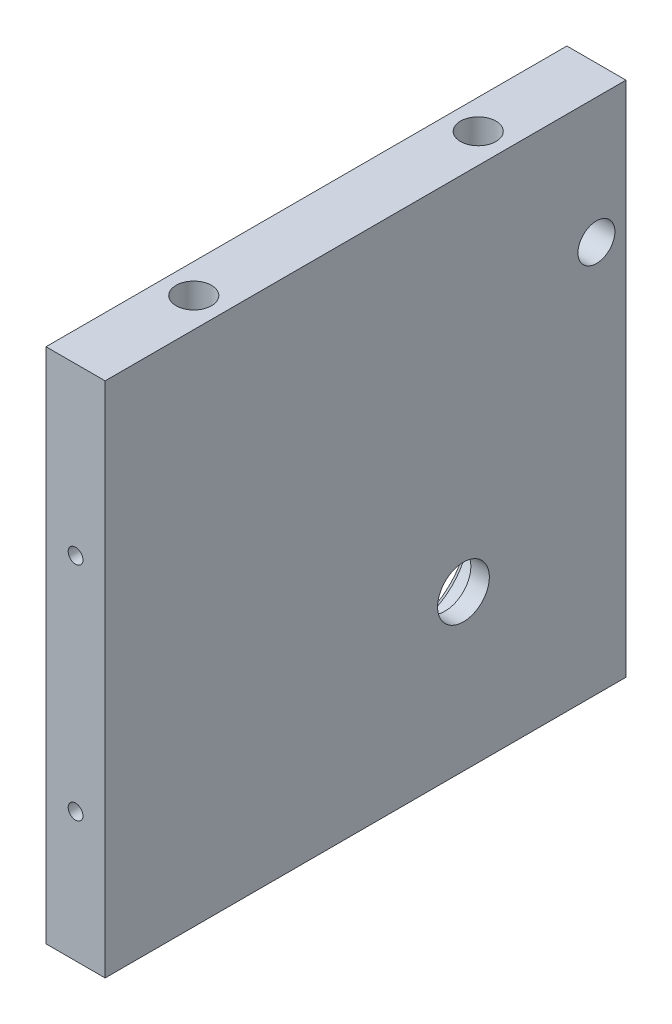
from build123d import *

# Parameters (mm, degrees)
SKETCH1_W                                           = 85
SKETCH1_H                                           = 70.5
BOSS_EXTRUDE1_DEPTH                                 = 70
SHELL1_T                                            = 8
CUT_EXTRUDE1_REACH                                  = 132.275
SKETCH2_R                                           = 3.5
CUT_EXTRUDE1_DIRECTION_2_DEPTH                      = 131.274949626
CBORE_FOR_M3_HEX_SOCKET_HEAD_CAP_SCREW1_D           = 3.8
CBORE_FOR_M3_HEX_SOCKET_HEAD_CAP_SCREW1_DEPTH       = 10
CBORE_FOR_M3_HEX_SOCKET_HEAD_CAP_SCREW1_CBORE_D     = 8
CBORE_FOR_M3_HEX_SOCKET_HEAD_CAP_SCREW1_CBORE_DEPTH = 3.4
CBORE_FOR_M3_HEX_SOCKET_HEAD_CAP_SCREW1_TIP         = 1.141635176
SKETCH14_W                                          = 12
SKETCH14_H                                          = 14
CUT_EXTRUDE3_DEPTH                                  = 5.5
SKETCH15_R                                          = 3.45
CUT_EXTRUDE4_DEPTH                                  = 101.60349149
SKETCH16_W                                          = 12
SKETCH16_H                                          = 2.5
CUT_EXTRUDE5_DEPTH                                  = 1.5
SKETCH17_W                                          = 7.1
SKETCH17_H                                          = 4.1
SKETCH17_W_2                                        = 7.8
SKETCH17_H_2                                        = 6
CUT_EXTRUDE6_DEPTH                                  = 97.544355091
CUT_EXTRUDE7_DEPTH                                  = 97.544355091
CUT_EXTRUDE8_DEPTH                                  = 125.175531003
CHAMFER2_SIZE                                       = 1
LPATTERN1_COUNT                                     = 5
LPATTERN1_PITCH                                     = 8
CHAMFER2_OF_LPATTERN1_SIZE                          = 1
CBORE_FOR_M3_HEX_SOCKET_HEAD_CAP_SCREW4_D           = 3.6
CBORE_FOR_M3_HEX_SOCKET_HEAD_CAP_SCREW4_DEPTH       = 10
CBORE_FOR_M3_HEX_SOCKET_HEAD_CAP_SCREW4_CBORE_D     = 6.5
CBORE_FOR_M3_HEX_SOCKET_HEAD_CAP_SCREW4_CBORE_DEPTH = 3.4
CBORE_FOR_M3_HEX_SOCKET_HEAD_CAP_SCREW4_TIP         = 1.081549114
SKETCH26_R                                          = 7.75
CUT_EXTRUDE9_DEPTH                                  = 5.5
CHAMFER1_SIZE                                       = 1
SKETCH28_R                                          = 2.4
CUT_EXTRUDE11_DEPTH                                 = 5.5
CHAMFER3_SIZE                                       = 1
FILLET4_R                                           = 3
SKETCH34_R                                          = 1
CUT_EXTRUDE13_DEPTH                                 = 20
CUT_EXTRUDE14_START                                 = -8
SKETCH35_R                                          = 2.4
CUT_EXTRUDE14_DEPTH                                 = 5.5
CBORE_FOR_M3_HEX_SOCKET_HEAD_CAP_SCREW5_D           = 3.6
CBORE_FOR_M3_HEX_SOCKET_HEAD_CAP_SCREW5_DEPTH       = 13.499
CBORE_FOR_M3_HEX_SOCKET_HEAD_CAP_SCREW5_CBORE_D     = 6.5
CBORE_FOR_M3_HEX_SOCKET_HEAD_CAP_SCREW5_CBORE_DEPTH = 3.4
SKETCH40_R                                          = 2.5
CUT_EXTRUDE16_DEPTH                                 = 131.274949737
CBORE_FOR_M4_HEX_SOCKET_HEAD_CAP_SCREW1_D           = 4.5
CBORE_FOR_M4_HEX_SOCKET_HEAD_CAP_SCREW1_DEPTH       = 18
CBORE_FOR_M4_HEX_SOCKET_HEAD_CAP_SCREW1_CBORE_D     = 8
CBORE_FOR_M4_HEX_SOCKET_HEAD_CAP_SCREW1_CBORE_DEPTH = 4.4
CBORE_FOR_M3_HEX_SOCKET_HEAD_CAP_SCREW6_D           = 3.4
CBORE_FOR_M3_HEX_SOCKET_HEAD_CAP_SCREW6_DEPTH       = 18
CBORE_FOR_M3_HEX_SOCKET_HEAD_CAP_SCREW6_CBORE_D     = 6.5
CBORE_FOR_M3_HEX_SOCKET_HEAD_CAP_SCREW6_CBORE_DEPTH = 3.4
CBORE_FOR_M3_HEX_SOCKET_HEAD_CAP_SCREW6_TIP         = 1.021463052
CUT_EXTRUDE18_REACH                                 = 124.199
SKETCH53_W                                          = 10
SKETCH53_H                                          = 6.8
SPLIT5_START                                        = -8
SPLIT5_OUTLINE_W                                    = 14
SPLIT5_OUTLINE_H                                    = 12
SPLIT5_OUTLINE_R                                    = 3.45
SPLIT5_OUTLINE_R_2                                  = 3.25
SPLIT5_OUTLINE_R_3                                  = 1.8
SPLIT5_OUTLINE_R_4                                  = 1.7
SPLIT5_DEPTH                                        = 78
SPLIT5_2_OUTLINE_W                                  = 14
SPLIT5_2_OUTLINE_H                                  = 12
SPLIT5_2_OUTLINE_R                                  = 3.25
SPLIT5_2_OUTLINE_W_2                                = 7.1
SPLIT5_2_OUTLINE_H_2                                = 4.1
SPLIT5_2_OUTLINE_W_3                                = 7.8
SPLIT5_2_OUTLINE_H_3                                = 6
SPLIT5_2_OUTLINE_R_2                                = 1.8
SPLIT5_2_DEPTH                                      = 8


# Read off the part's stored shape, not the designer's step: Split5
with BuildPart() as part:
    # Sketch1 → Boss-Extrude1 (new body)
    with BuildSketch(Plane(origin=(0, 0, 0), x_dir=(1, 0, 0), z_dir=(0, 1, 0))):
        Rectangle(SKETCH1_W, SKETCH1_H)
    extrude(amount=BOSS_EXTRUDE1_DEPTH)

    # Shell1
    shell1_openings = [part.faces().sort_by_distance(p)[0] for p in [
        (0, 70, 0),
    ]]
    offset(amount=SHELL1_T, openings=shell1_openings, kind=Kind.INTERSECTION)

    # Sketch2 → Cut-Extrude1 (cut, up to next)
    with BuildSketch(Plane(origin=(50.5, 0, 0), x_dir=(0, 0, -1), z_dir=(1, 0, 0)), mode=Mode.PRIVATE) as cut_extrude1_sk1:
        with Locations(Location((13.25, 21, 0), (0, 0, 180))):
            Circle(SKETCH2_R)
    cut_extrude1_tool1 = extrude(cut_extrude1_sk1.sketch, amount=-CUT_EXTRUDE1_REACH, mode=Mode.PRIVATE) & part.part
    add(cut_extrude1_tool1.solids().sort_by_distance((50.5, 21, -13.25))[0], mode=Mode.SUBTRACT)

    # Sketch2 → Cut-Extrude1 direction 2 (cut)
    with BuildSketch(Plane(origin=(50.5, 0, 0), x_dir=(0, 0, -1), z_dir=(1, 0, 0))):
        with Locations(Location((13.25, 21, 0), (0, 0, 180))):
            Circle(SKETCH2_R)
    extrude(amount=CUT_EXTRUDE1_DIRECTION_2_DEPTH, mode=Mode.SUBTRACT)

    # CBORE for M3 Hex Socket Head Cap Screw1
    with Locations(Plane.XY.offset(43.25)):
        with Locations((-34, 55.5), (-3, 55.5), (-34, 24.5)):
            CounterBoreHole(CBORE_FOR_M3_HEX_SOCKET_HEAD_CAP_SCREW1_D / 2, CBORE_FOR_M3_HEX_SOCKET_HEAD_CAP_SCREW1_CBORE_D / 2, CBORE_FOR_M3_HEX_SOCKET_HEAD_CAP_SCREW1_CBORE_DEPTH, depth=CBORE_FOR_M3_HEX_SOCKET_HEAD_CAP_SCREW1_DEPTH)
            with Locations((0, 0, -(CBORE_FOR_M3_HEX_SOCKET_HEAD_CAP_SCREW1_DEPTH + CBORE_FOR_M3_HEX_SOCKET_HEAD_CAP_SCREW1_TIP / 2))):  # 118° drill point
                Cone(0, CBORE_FOR_M3_HEX_SOCKET_HEAD_CAP_SCREW1_D / 2, CBORE_FOR_M3_HEX_SOCKET_HEAD_CAP_SCREW1_TIP, mode=Mode.SUBTRACT)

    # Sketch14 → Cut-Extrude3 (cut)
    with BuildSketch(Plane(origin=(-42.5, 0, 0), x_dir=(0, 0, -1), z_dir=(0, 1, 0))):
        with Locations((-17.25, -13)):
            Rectangle(SKETCH14_W, SKETCH14_H)
    extrude(amount=-CUT_EXTRUDE3_DEPTH, mode=Mode.SUBTRACT)

    # Sketch15 → Cut-Extrude4 (cut, through all)
    with BuildSketch(Plane(origin=(0, -5.5, 0), x_dir=(0, 0, -1), z_dir=(0, 1, 0))):
        with Locations(Location((-17.25, 29.5, 0), (0, 0, 90))):
            Circle(SKETCH15_R)
    extrude(amount=-CUT_EXTRUDE4_DEPTH, mode=Mode.SUBTRACT)

    # Sketch16 → Cut-Extrude5 (cut)
    with BuildSketch(Plane(origin=(0, -5.5, 0), x_dir=(0, 0, -1), z_dir=(0, 1, 0))):
        with Locations((-17.25, 35.25)):
            Rectangle(SKETCH16_W, SKETCH16_H)
    extrude(amount=-CUT_EXTRUDE5_DEPTH, mode=Mode.SUBTRACT)

    # Sketch17 → Cut-Extrude6 (cut, through all)
    with BuildSketch(Plane(origin=(0, 0, 0), x_dir=(1, 0, 0), z_dir=(0, 1, 0))):
        with Locations((19.15, -29.25)):
            Rectangle(SKETCH17_W, SKETCH17_H)
        with Locations((30.6, -29.25)):
            Rectangle(SKETCH17_W_2, SKETCH17_H_2)
    extrude(amount=-CUT_EXTRUDE6_DEPTH, mode=Mode.SUBTRACT)

    # Sketch18 → Cut-Extrude7 (cut, through all)
    with BuildSketch(Plane(origin=(0, 0, 0), x_dir=(1, 0, 0), z_dir=(0, 1, 0))):
        with BuildLine():
            Line((-19.5, -29.25), (-19.5, -21.25))
            ThreePointArc((-19.5, -21.25), (-17.5, -19.25), (-15.5, -21.25))
            Line((-15.5, -21.25), (-15.5, -29.25))
            ThreePointArc((-15.5, -29.25), (-17.5, -31.25), (-19.5, -29.25))
        make_face()
        with BuildLine():
            Line((-7.5, -29.25), (-7.5, -21.25))
            ThreePointArc((-7.5, -21.25), (-9.5, -19.25), (-11.5, -21.25))
            Line((-11.5, -21.25), (-11.5, -29.25))
            ThreePointArc((-11.5, -29.25), (-9.5, -31.25), (-7.5, -29.25))
        make_face()
    extrude(amount=-CUT_EXTRUDE7_DEPTH, mode=Mode.SUBTRACT)

    # Sketch19 → Cut-Extrude8 (cut, through all)
    with BuildSketch(Plane(origin=(-42.5, 0, 0), x_dir=(0, 0, -1), z_dir=(1, 0, 0))):
        with BuildLine():
            Line((-27.75, 60), (-27.75, 15))
            ThreePointArc((-27.75, 15), (-29.25, 13.5), (-30.75, 15))
            Line((-30.75, 15), (-30.75, 60))
            ThreePointArc((-30.75, 60), (-29.25, 61.5), (-27.75, 60))
        make_face()
    cut_extrude8 = extrude(amount=-CUT_EXTRUDE8_DEPTH, mode=Mode.SUBTRACT)

    # Chamfer2
    chamfer2_edges = [part.edges().sort_by_distance(p)[0] for p in [
        (-50.5, 61.5, 29.25),
        (-50.5, 37.5, 27.75),
        (-50.5, 13.5, 29.25),
        (-50.5, 37.5, 30.75),
        (-42.5, 61.5, 29.25),
        (-42.5, 37.5, 30.75),
        (-42.5, 13.5, 29.25),
        (-42.5, 37.5, 27.75),
    ]]
    chamfer(chamfer2_edges, length=CHAMFER2_SIZE)

    # LPattern1: Cut-Extrude8 ×5
    with Locations(*[(0, 0, -i * LPATTERN1_PITCH) for i in range(1, LPATTERN1_COUNT)]):
        add(cut_extrude8, mode=Mode.SUBTRACT)

    # Chamfer2 of LPattern1
    chamfer2_of_lpattern1_edges = [part.edges().sort_by_distance(p)[0] for p in [
        (-50.5, 61.5, 21.25),
        (-50.5, 37.5, 19.75),
        (-50.5, 13.5, 21.25),
        (-50.5, 37.5, 22.75),
        (-42.5, 61.5, 21.25),
        (-42.5, 37.5, 22.75),
        (-42.5, 13.5, 21.25),
        (-42.5, 37.5, 19.75),
        (-50.5, 61.5, 13.25),
        (-50.5, 37.5, 11.75),
        (-50.5, 13.5, 13.25),
        (-50.5, 37.5, 14.75),
        (-42.5, 61.5, 13.25),
        (-42.5, 37.5, 14.75),
        (-42.5, 13.5, 13.25),
        (-42.5, 37.5, 11.75),
        (-50.5, 61.5, 5.25),
        (-50.5, 37.5, 3.75),
        (-50.5, 13.5, 5.25),
        (-50.5, 37.5, 6.75),
        (-42.5, 61.5, 5.25),
        (-42.5, 37.5, 6.75),
        (-42.5, 13.5, 5.25),
        (-42.5, 37.5, 3.75),
        (-50.5, 61.5, -2.75),
        (-50.5, 37.5, -4.25),
        (-50.5, 13.5, -2.75),
        (-50.5, 37.5, -1.25),
        (-42.5, 61.5, -2.75),
        (-42.5, 37.5, -1.25),
        (-42.5, 13.5, -2.75),
        (-42.5, 37.5, -4.25),
    ]]
    chamfer(chamfer2_of_lpattern1_edges, length=CHAMFER2_OF_LPATTERN1_SIZE)

    # CBORE for M3 Hex Socket Head Cap Screw4
    with Locations(Plane(origin=(0, 0, 0), x_dir=(1, 0, 0), z_dir=(0, 1, 0))):
        with Locations((33.5, 23.25), (33.5, 3.25), (13.5, 13.25), (-6.5, 23.25), (-6.5, 3.25)):
            CounterBoreHole(CBORE_FOR_M3_HEX_SOCKET_HEAD_CAP_SCREW4_D / 2, CBORE_FOR_M3_HEX_SOCKET_HEAD_CAP_SCREW4_CBORE_D / 2, CBORE_FOR_M3_HEX_SOCKET_HEAD_CAP_SCREW4_CBORE_DEPTH, depth=CBORE_FOR_M3_HEX_SOCKET_HEAD_CAP_SCREW4_DEPTH)
            with Locations((0, 0, -(CBORE_FOR_M3_HEX_SOCKET_HEAD_CAP_SCREW4_DEPTH + CBORE_FOR_M3_HEX_SOCKET_HEAD_CAP_SCREW4_TIP / 2))):  # 118° drill point
                Cone(0, CBORE_FOR_M3_HEX_SOCKET_HEAD_CAP_SCREW4_D / 2, CBORE_FOR_M3_HEX_SOCKET_HEAD_CAP_SCREW4_TIP, mode=Mode.SUBTRACT)

    # Sketch26 → Cut-Extrude9 (cut)
    with BuildSketch(Plane.ZY.offset(-42.5)):
        with Locations((-13.25, 21)):
            Circle(SKETCH26_R)
    extrude(amount=-CUT_EXTRUDE9_DEPTH, mode=Mode.SUBTRACT)

    # Chamfer1
    chamfer1_edges = [part.edges().sort_by_distance(p)[0] for p in [
        (42.5, 21, -21),
    ]]
    chamfer(chamfer1_edges, length=CHAMFER1_SIZE)

    # Sketch28 → Cut-Extrude11 (cut)
    with BuildSketch(Plane(origin=(0, 70, 0), x_dir=(1, 0, 0), z_dir=(0, 1, 0))):
        with Locations(Location((-26.5, 39.25, 0), (0, 0, 270))):
            Circle(SKETCH28_R)
        with Locations(Location((-46.5, 19.25, 0), (0, 0, 270))):
            Circle(SKETCH28_R)
        with Locations(Location((46.5, 19.25, 0), (0, 0, 90))):
            Circle(SKETCH28_R)
        with Locations(Location((26.5, 39.25, 0), (0, 0, 90))):
            Circle(SKETCH28_R)
        with Locations(Location((26.5, -39.25, 0), (0, 0, 270))):
            Circle(SKETCH28_R)
        with Locations(Location((46.5, -19.25, 0), (0, 0, 270))):
            Circle(SKETCH28_R)
        with Locations(Location((-46.5, -19.25, 0), (0, 0, 90))):
            Circle(SKETCH28_R)
        with Locations(Location((-26.5, -39.25, 0), (0, 0, 90))):
            Circle(SKETCH28_R)
    extrude(amount=-CUT_EXTRUDE11_DEPTH, mode=Mode.SUBTRACT)

    # Chamfer3
    chamfer3_edges = [part.edges().sort_by_distance(p)[0] for p in [
        (34.5, 0, 29.25),
        (30.6, 0, 26.25),
        (26.7, 0, 29.25),
        (30.6, 0, 32.25),
        (22.7, 0, 29.25),
        (19.15, 0, 27.2),
        (15.6, 0, 29.25),
        (19.15, 0, 31.3),
    ]]
    chamfer(chamfer3_edges, length=CHAMFER3_SIZE)

    # Fillet4
    fillet4_edges = [part.edges().sort_by_distance(p)[0] for p in [
        (0, -8, 43.25),
        (-50.5, -8, 0),
        (0, -8, -43.25),
        (50.5, -8, 0),
        (50.5, 31, 43.25),
        (-50.5, 31, 43.25),
        (-50.5, 31, -43.25),
        (50.5, 31, -43.25),
    ]]
    fillet(fillet4_edges, radius=FILLET4_R)

    # Sketch34 → Cut-Extrude13 (cut)
    with BuildSketch(Plane(origin=(0, 0, -43.25), x_dir=(-1, 0, 0), z_dir=(0, 0, -1))):
        with Locations((-46.5, 47.5)):
            Circle(SKETCH34_R)
        with Locations(Location((-46.5, 17.5, 0), (0, 0, 180))):
            Circle(SKETCH34_R)
        with Locations((46.5, 17.5)):
            Circle(SKETCH34_R)
        with Locations((46.5, 47.5)):
            Circle(SKETCH34_R)
    cut_extrude13 = extrude(amount=-CUT_EXTRUDE13_DEPTH, mode=Mode.SUBTRACT)

    # Mirror2: Cut-Extrude13 across plane
    add(cut_extrude13.mirror(Plane.XY), mode=Mode.SUBTRACT)

    # Sketch35 → Cut-Extrude14 (cut)
    with BuildSketch(Plane.XZ.offset(8).offset(CUT_EXTRUDE14_START)):
        with Locations(Location((46.5, 25.25, 0), (0, 0, 270))):
            Circle(SKETCH35_R)
        with Locations(Location((46.5, -25.25, 0), (0, 0, 270))):
            Circle(SKETCH35_R)
        with Locations(Location((-46.5, -25.25, 0), (0, 0, 270))):
            Circle(SKETCH35_R)
        with Locations(Location((-46.5, 25.25, 0), (0, 0, 270))):
            Circle(SKETCH35_R)
        with Locations(Location((32.5, 39.25, 0), (0, 0, 270))):
            Circle(SKETCH35_R)
        with Locations(Location((-32.5, 39.25, 0), (0, 0, 270))):
            Circle(SKETCH35_R)
        with Locations(Location((-32.5, -39.25, 0), (0, 0, 270))):
            Circle(SKETCH35_R)
        with Locations(Location((32.5, -39.25, 0), (0, 0, 270))):
            Circle(SKETCH35_R)
    extrude(amount=-CUT_EXTRUDE14_DEPTH, mode=Mode.SUBTRACT)

    # CBORE for M3 Hex Socket Head Cap Screw5
    with Locations(Plane(origin=(0, -8, 0), x_dir=(-1, 0, 0), z_dir=(0, -1, 0))):
        with Locations((-46.5, -25.25), (46.5, -25.25), (46.5, 25.25), (32.5, 39.25), (-32.5, 39.25), (-46.5, 25.25), (-32.5, -39.25), (32.5, -39.25)):
            CounterBoreHole(CBORE_FOR_M3_HEX_SOCKET_HEAD_CAP_SCREW5_D / 2, CBORE_FOR_M3_HEX_SOCKET_HEAD_CAP_SCREW5_CBORE_D / 2, CBORE_FOR_M3_HEX_SOCKET_HEAD_CAP_SCREW5_CBORE_DEPTH, depth=CBORE_FOR_M3_HEX_SOCKET_HEAD_CAP_SCREW5_DEPTH)

    # Sketch40 → Cut-Extrude16 (cut, through all)
    with BuildSketch(Plane(origin=(50.5, 0, 0), x_dir=(0, 0, -1), z_dir=(1, 0, 0))):
        with Locations((31.25, 53)):
            Circle(SKETCH40_R)
    extrude(amount=-CUT_EXTRUDE16_DEPTH, mode=Mode.SUBTRACT)

    # CBORE for M4 Hex Socket Head Cap Screw1
    with Locations(Plane(origin=(0, -8, 0), x_dir=(-1, 0, 0), z_dir=(0, -1, 0))):
        with Locations((-24.7, 38.75), (6, 38.75)):
            CounterBoreHole(CBORE_FOR_M4_HEX_SOCKET_HEAD_CAP_SCREW1_D / 2, CBORE_FOR_M4_HEX_SOCKET_HEAD_CAP_SCREW1_CBORE_D / 2, CBORE_FOR_M4_HEX_SOCKET_HEAD_CAP_SCREW1_CBORE_DEPTH, depth=CBORE_FOR_M4_HEX_SOCKET_HEAD_CAP_SCREW1_DEPTH)

    # CBORE for M3 Hex Socket Head Cap Screw6
    with Locations(Plane(origin=(0, -8, 0), x_dir=(-1, 0, 0), z_dir=(0, -1, 0))):
        with Locations((-24.7, -12.25), (6, -12.25)):
            CounterBoreHole(CBORE_FOR_M3_HEX_SOCKET_HEAD_CAP_SCREW6_D / 2, CBORE_FOR_M3_HEX_SOCKET_HEAD_CAP_SCREW6_CBORE_D / 2, CBORE_FOR_M3_HEX_SOCKET_HEAD_CAP_SCREW6_CBORE_DEPTH, depth=CBORE_FOR_M3_HEX_SOCKET_HEAD_CAP_SCREW6_DEPTH)
            with Locations((0, 0, -(CBORE_FOR_M3_HEX_SOCKET_HEAD_CAP_SCREW6_DEPTH + CBORE_FOR_M3_HEX_SOCKET_HEAD_CAP_SCREW6_TIP / 2))):  # 118° drill point
                Cone(0, CBORE_FOR_M3_HEX_SOCKET_HEAD_CAP_SCREW6_D / 2, CBORE_FOR_M3_HEX_SOCKET_HEAD_CAP_SCREW6_TIP, mode=Mode.SUBTRACT)

    # Cut-Extrude18: up to this face of the body (flat: up to its plane)
    cut_extrude18_end = Plane(part.part.faces().sort_by_distance((0, 35, -35.25))[0])
    # Sketch53 → Cut-Extrude18 (cut, up to the picked face)
    with BuildSketch(Plane(origin=(0, 0, -43.25), x_dir=(-1, 0, 0), z_dir=(0, 0, -1)), mode=Mode.PRIVATE) as cut_extrude18_sk1:
        with Locations((-24.7, 3.4)):
            Rectangle(SKETCH53_W, SKETCH53_H)
    cut_extrude18_tool1 = split(extrude(cut_extrude18_sk1.sketch, amount=-CUT_EXTRUDE18_REACH, mode=Mode.PRIVATE), bisect_by=cut_extrude18_end, keep=Keep.BOTH, mode=Mode.PRIVATE)
    # Sketch53 → Cut-Extrude18 (cut, up to the picked face)
    with BuildSketch(Plane(origin=(0, 0, -43.25), x_dir=(-1, 0, 0), z_dir=(0, 0, -1)), mode=Mode.PRIVATE) as cut_extrude18_sk2:
        with Locations((6, 3.4)):
            Rectangle(SKETCH53_W, SKETCH53_H)
    cut_extrude18_tool2 = split(extrude(cut_extrude18_sk2.sketch, amount=-CUT_EXTRUDE18_REACH, mode=Mode.PRIVATE), bisect_by=cut_extrude18_end, keep=Keep.BOTH, mode=Mode.PRIVATE)
    add(cut_extrude18_tool1.solids().sort_by(Axis((24.7, 3.4, -43.25), (0, 0, 1)))[0], mode=Mode.SUBTRACT)
    add(cut_extrude18_tool2.solids().sort_by(Axis((-6, 3.4, -43.25), (0, 0, 1)))[0], mode=Mode.SUBTRACT)

    # Split5 outline → Split5 (cut)
    # profile 1 of 9: a face of its own
    with BuildSketch(Plane(origin=(0, 0, 0), x_dir=(1, 0, 0), z_dir=(0, 1, 0)).offset(SPLIT5_START)):
        with BuildLine():
            Line((50.5, -40.25), (50.5, -35.25))
            Line((50.5, -35.25), (-42.5, -35.25))
            Line((-42.5, -35.25), (-42.5, 35.25))
            Line((-42.5, 35.25), (-7.936491673, 35.25))
            ThreePointArc((-7.936491673, 35.25), (-6, 34.75), (-4.063508327, 35.25))
            Line((-4.063508327, 35.25), (22.763508327, 35.25))
            ThreePointArc((22.763508327, 35.25), (24.7, 34.75), (26.636491673, 35.25))
            Line((26.636491673, 35.25), (50.5, 35.25))
            Line((50.5, 35.25), (50.5, 40.25))
            ThreePointArc((50.5, 40.25), (49.621320344, 42.371320344), (47.5, 43.25))
            Line((47.5, 43.25), (-47.5, 43.25))
            ThreePointArc((-47.5, 43.25), (-49.621320344, 42.371320344), (-50.5, 40.25))
            Line((-50.5, 40.25), (-50.5, -40.25))
            ThreePointArc((-50.5, -40.25), (-49.621320344, -42.371320344), (-47.5, -43.25))
            Line((-47.5, -43.25), (47.5, -43.25))
            ThreePointArc((47.5, -43.25), (49.621320344, -42.371320344), (50.5, -40.25))
        make_face()
    # profile 2 of 9: a face of its own
    with BuildSketch(Plane(origin=(0, 0, 0), x_dir=(1, 0, 0), z_dir=(0, 1, 0)).offset(SPLIT5_START)):
        with Locations((-29.5, -17.25)):
            Rectangle(SPLIT5_OUTLINE_W, SPLIT5_OUTLINE_H)
        with Locations((-29.5, -17.25)):
            Circle(SPLIT5_OUTLINE_R, mode=Mode.SUBTRACT)
    # profile 3 of 9: a face of its own
    with BuildSketch(Plane(origin=(0, 0, 0), x_dir=(1, 0, 0), z_dir=(0, 1, 0)).offset(SPLIT5_START)):
        with Locations((-6.5, 3.25)):
            Circle(SPLIT5_OUTLINE_R_2)
        with Locations((-6.5, 3.25)):
            Circle(SPLIT5_OUTLINE_R_3, mode=Mode.SUBTRACT)
    # profile 4 of 9: a face of its own
    with BuildSketch(Plane(origin=(0, 0, 0), x_dir=(1, 0, 0), z_dir=(0, 1, 0)).offset(SPLIT5_START)):
        with Locations((-6.5, 23.25)):
            Circle(SPLIT5_OUTLINE_R_2)
        with Locations((-6.5, 23.25)):
            Circle(SPLIT5_OUTLINE_R_3, mode=Mode.SUBTRACT)
    # profile 5 of 9: a face of its own
    with BuildSketch(Plane(origin=(0, 0, 0), x_dir=(1, 0, 0), z_dir=(0, 1, 0)).offset(SPLIT5_START)):
        with Locations((13.5, 13.25)):
            Circle(SPLIT5_OUTLINE_R_2)
        with Locations((13.5, 13.25)):
            Circle(SPLIT5_OUTLINE_R_3, mode=Mode.SUBTRACT)
    # profile 6 of 9: a face of its own
    with BuildSketch(Plane(origin=(0, 0, 0), x_dir=(1, 0, 0), z_dir=(0, 1, 0)).offset(SPLIT5_START)):
        with Locations((33.5, 3.25)):
            Circle(SPLIT5_OUTLINE_R_2)
        with Locations((33.5, 3.25)):
            Circle(SPLIT5_OUTLINE_R_3, mode=Mode.SUBTRACT)
    # profile 7 of 9: a face of its own
    with BuildSketch(Plane(origin=(0, 0, 0), x_dir=(1, 0, 0), z_dir=(0, 1, 0)).offset(SPLIT5_START)):
        with Locations((33.5, 23.25)):
            Circle(SPLIT5_OUTLINE_R_2)
        with Locations((33.5, 23.25)):
            Circle(SPLIT5_OUTLINE_R_3, mode=Mode.SUBTRACT)
    # profile 8 of 9: a face of its own
    with BuildSketch(Plane(origin=(0, 0, 0), x_dir=(1, 0, 0), z_dir=(0, 1, 0)).offset(SPLIT5_START)):
        with Locations((-6, -12.25)):
            Circle(SPLIT5_OUTLINE_R_2)
        with Locations((-6, -12.25)):
            Circle(SPLIT5_OUTLINE_R_4, mode=Mode.SUBTRACT)
    # profile 9 of 9: a face of its own
    with BuildSketch(Plane(origin=(0, 0, 0), x_dir=(1, 0, 0), z_dir=(0, 1, 0)).offset(SPLIT5_START)):
        with Locations((24.7, -12.25)):
            Circle(SPLIT5_OUTLINE_R_2)
        with Locations((24.7, -12.25)):
            Circle(SPLIT5_OUTLINE_R_4, mode=Mode.SUBTRACT)
    extrude(amount=SPLIT5_DEPTH, mode=Mode.SUBTRACT)

    # Split5 2 outline → Split5 2 (cut)
    with BuildSketch(Plane(origin=(0, 0, 0), x_dir=(1, 0, 0), z_dir=(0, 1, 0)).offset(SPLIT5_START)):
        with BuildLine():
            Line((50.5, -35.25), (50.5, 35.25))
            Line((50.5, 35.25), (26.636491673, 35.25))
            ThreePointArc((26.636491673, 35.25), (24.7, 34.75), (22.763508327, 35.25))
            Line((22.763508327, 35.25), (-4.063508327, 35.25))
            ThreePointArc((-4.063508327, 35.25), (-6, 34.75), (-7.936491673, 35.25))
            Line((-7.936491673, 35.25), (-42.5, 35.25))
            Line((-42.5, 35.25), (-42.5, -35.25))
            Line((-42.5, -35.25), (50.5, -35.25))
        make_face()
        with BuildLine():
            ThreePointArc((-15.5, -29.25), (-17.5, -31.25), (-19.5, -29.25))
            Line((-19.5, -29.25), (-19.5, -21.25))
            ThreePointArc((-19.5, -21.25), (-17.5, -19.25), (-15.5, -21.25))
            Line((-15.5, -21.25), (-15.5, -29.25))
        make_face(mode=Mode.SUBTRACT)
        with BuildLine():
            ThreePointArc((-7.5, -29.25), (-9.5, -31.25), (-11.5, -29.25))
            Line((-11.5, -29.25), (-11.5, -21.25))
            ThreePointArc((-11.5, -21.25), (-9.5, -19.25), (-7.5, -21.25))
            Line((-7.5, -21.25), (-7.5, -29.25))
        make_face(mode=Mode.SUBTRACT)
        with Locations((-29.5, -17.25)):
            Rectangle(SPLIT5_2_OUTLINE_W, SPLIT5_2_OUTLINE_H, mode=Mode.SUBTRACT)
        with Locations((-6, -12.25)):
            Circle(SPLIT5_2_OUTLINE_R, mode=Mode.SUBTRACT)
        with Locations((19.15, -29.25)):
            Rectangle(SPLIT5_2_OUTLINE_W_2, SPLIT5_2_OUTLINE_H_2, mode=Mode.SUBTRACT)
        with Locations((30.6, -29.25)):
            Rectangle(SPLIT5_2_OUTLINE_W_3, SPLIT5_2_OUTLINE_H_3, mode=Mode.SUBTRACT)
        with Locations((24.7, -12.25)):
            Circle(SPLIT5_2_OUTLINE_R, mode=Mode.SUBTRACT)
        with Locations((-6.5, 3.25)):
            Circle(SPLIT5_2_OUTLINE_R, mode=Mode.SUBTRACT)
        with Locations((-6.5, 23.25)):
            Circle(SPLIT5_2_OUTLINE_R, mode=Mode.SUBTRACT)
        with Locations((13.5, 13.25)):
            Circle(SPLIT5_2_OUTLINE_R, mode=Mode.SUBTRACT)
        with Locations((33.5, 3.25)):
            Circle(SPLIT5_2_OUTLINE_R, mode=Mode.SUBTRACT)
        with Locations((33.5, 23.25)):
            Circle(SPLIT5_2_OUTLINE_R, mode=Mode.SUBTRACT)
        with Locations((46.5, -25.25)):
            Circle(SPLIT5_2_OUTLINE_R_2, mode=Mode.SUBTRACT)
        with Locations((46.5, 25.25)):
            Circle(SPLIT5_2_OUTLINE_R_2, mode=Mode.SUBTRACT)
    extrude(amount=SPLIT5_2_DEPTH, mode=Mode.SUBTRACT)


solid = part.part
